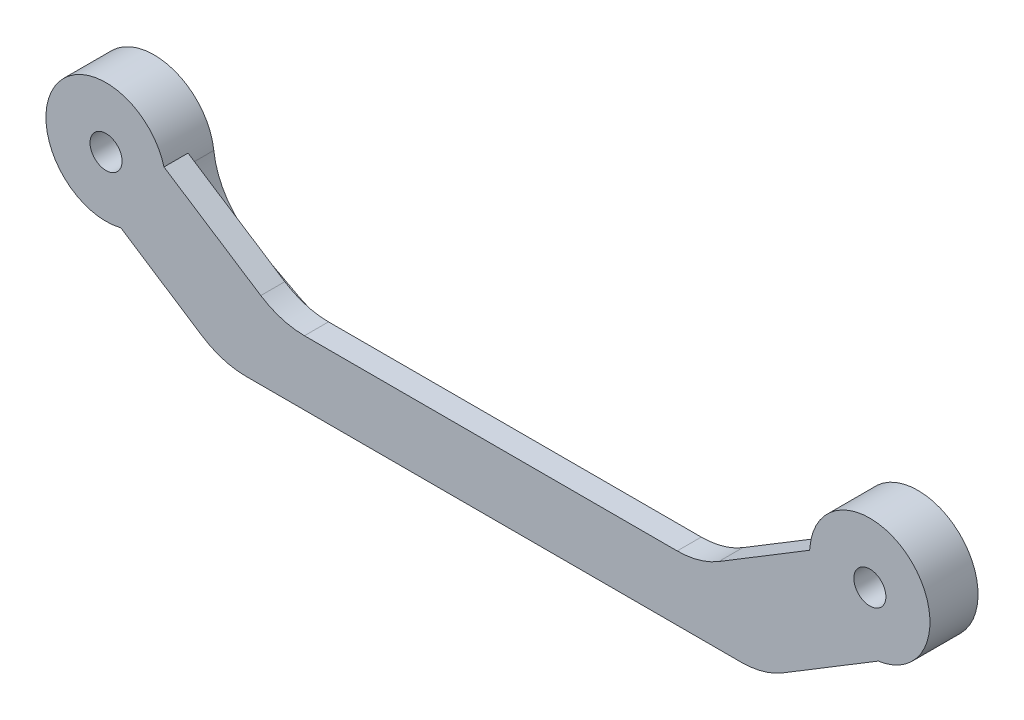
from build123d import *
from build123d.topology import SkipClean

# Parameters (mm, degrees)
EXTRUDE_1_DEPTH     = 3
SKETCH_2_R          = 2
SKETCH_2_R_2        = 1.9999999999999967
CUT_EXTRUDE_1_DEPTH = 105.01455903133225
EXTRUDE_START       = 3
SKETCH_3_R          = 1.9999999999999962
SKETCH_3_R_2        = 2
EXTRUDE_9_DEPTH     = 3
FILLET_1_R          = 10
FILLET_2_R          = 10


with BuildPart() as part:
    # 草图1 → 凸台-拉伸1 (new body)
    with BuildSketch(Plane.XY):
        with BuildLine():
            Line((21.79390335077292, -7.475214596472519), (7.229933319640558, 1.9945085092702048))
            ThreePointArc((7.229933319640558, 1.9945085092702048), (-6.483154274799016, 3.7707705643747733), (1.8411668544431816, -7.270495486148093))
            Line((1.8411668544431845, -7.270495486148092), (14.486878939127898, -15.510906506800303))
            Line((14.486878939127898, -15.510906506800302), (82.06831155956868, -15.510906506800302))
            Line((82.06831155956867, -15.510906506800302), (96.3582789784704, -6.83317051644414))
            ThreePointArc((96.35827897847041, -6.833170516444138), (100.33032000817497, 6.162825901013469), (87.812990018917, 0.8723171575890092))
            Line((87.81299001891699, 0.8723171575890003), (74.06678283695699, -7.475214596472519))
            Line((74.06678283695699, -7.475214596472519), (21.79390335077292, -7.475214596472519))
        make_face()
    extrude(amount=EXTRUDE_1_DEPTH)

    # 草图2 → 切除-拉伸1 (cut, through all)
    with BuildSketch(Plane.XY.offset(3)):
        Circle(SKETCH_2_R)
        with Locations((95.30778311888552, 0.5928956325337316)):
            Circle(SKETCH_2_R_2)
    extrude(amount=-CUT_EXTRUDE_1_DEPTH, mode=Mode.SUBTRACT)

    # 草图3 → 凸台-拉伸9 (add)
    # profile 1 of 3: a face of its own
    with SkipClean():  # the faces are left unmerged after this step: merging them gives an invalid solid
        with BuildSketch(Plane(origin=(0, 0, 0), x_dir=(-1, 0, 0), z_dir=(0, 0, -1)).offset(EXTRUDE_START)):
            with BuildLine():
                ThreePointArc((-91.01590945402396, -5.557699496790565), (-89.75367146553334, -4.447128548171897), (-88.77053253167215, -3.0832918980444344))
                ThreePointArc((-88.77053253167215, -3.0832918980444344), (-88.05246164412989, -1.3071860230668506), (-87.80778311888552, 0.5928956325337297))
                ThreePointArc((-87.80778311888552, 0.5928956325337316), (-87.80908495687888, 0.7326306500420054), (-87.812990018917, 0.8723171575890011))
                ThreePointArc((-87.81299001891699, 0.8723171575890014), (-100.33032000817497, 6.162825901013491), (-96.35827897847041, -6.833170516444131))
                ThreePointArc((-96.35827897847042, -6.833170516444138), (-93.56613473312304, -6.702079412000068), (-91.01590945402396, -5.557699496790565))
            make_face()
            with Locations(Location((-95.30778311888552, 0.5928956325337316, 0), (0, 0, 180))):
                Circle(SKETCH_3_R, mode=Mode.SUBTRACT)
        # profile 2 of 3: a face of its own
        with BuildSketch(Plane(origin=(0, 0, 0), x_dir=(-1, 0, 0), z_dir=(0, 0, -1)).offset(EXTRUDE_START)):
            with BuildLine():
                Line((-75.05143042110615, -10.798154811245045), (-88.77053253167215, -3.0832918980444335))
                ThreePointArc((-88.77053253167215, -3.0832918980444344), (-89.75367146553334, -4.447128548171897), (-91.01590945402396, -5.557699496790565))
                Line((-91.01590945402396, -5.557699496790569), (-76.64805579661679, -13.637384335527532))
                Line((-76.64805579661679, -13.637384335527532), (-18.81509472588799, -13.637384335527532))
                Line((-18.81509472588799, -13.637384335527532), (-4.475261433860523, -6.018474482674216))
                ThreePointArc((-4.475261433860524, -6.018474482674214), (-5.688218997555007, -4.8881657741789315), (-6.623200748856248, -3.5189788064650287))
                Line((-6.623200748856245, -3.5189788064650287), (-20.323608343622624, -10.798154811245045))
                Line((-20.323608343622624, -10.798154811245045), (-75.05143042110615, -10.798154811245045))
            make_face()
        # profile 3 of 3: a face of its own
        with BuildSketch(Plane(origin=(0, 0, 0), x_dir=(-1, 0, 0), z_dir=(0, 0, -1)).offset(EXTRUDE_START)):
            with BuildLine():
                ThreePointArc((-7.229933319640558, 1.9945085092702044), (-7.454996074789714, -0.8203862047048063), (-6.623200748856248, -3.5189788064650287))
                ThreePointArc((-6.623200748856248, -3.5189788064650287), (-5.688218997555007, -4.8881657741789315), (-4.475261433860524, -6.018474482674214))
                ThreePointArc((-4.475261433860524, -6.018474482674214), (-3.2196592565993294, -6.773757765922417), (-1.8411668544431843, -7.270495486148093))
                ThreePointArc((-1.8411668544431843, -7.270495486148093), (4.606584884254069, -5.918561962517747), (7.5, -1.84e-15))
                ThreePointArc((7.5, 0), (1.00635483371816, 7.432176662906506), (-7.229933319640558, 1.9945085092702044))
            make_face()
            with Locations(Location((0, 0, 0), (0, 0, 180))):
                Circle(SKETCH_3_R_2, mode=Mode.SUBTRACT)
        extrude(amount=-EXTRUDE_9_DEPTH)

    # 圆角1
    # the kernel refuses this fillet: 10 mm, written as the material it adds along each edge
    with BuildSketch(Plane(origin=(88.77053253167215, -3.083291898044434, -3), x_dir=(-0.20664882712832097, 0.9784151788716738, 0), z_dir=(0, 0, 1))) as fillet_1_piece_1_section:
        with BuildLine():
            CenterArc((7.4864083793494025, 9.541100058820126), FILLET_1_R, 197.4249522895106, 55.15009542096897)
            Line((-2.0546916794712278, 6.546536707082027), (0, 0))
            ThreePointArc((0, 0), (2.245922513804829, 0.34417495588492364), (4.491845027609668, -5e-17))
        make_face()
    fillet_1_piece_1 = extrude(amount=20.153516540869376, mode=Mode.PRIVATE)
    fillet_1_piece_1 = split(fillet_1_piece_1, bisect_by=Plane(origin=(86.96414266235654, -3.033123271198268, 3), z_dir=(0, 0, -1)), keep=Keep.TOP, mode=Mode.PRIVATE)
    add(fillet_1_piece_1)
    with BuildSketch(Plane(origin=(91.01590945402396, -5.557699496790567, -3), x_dir=(0.9194568899378542, -0.39319082841008474, 0), z_dir=(0, 0, 1))) as fillet_1_piece_2:
        with BuildLine():
            CenterArc((5.092784059285759, -9.790309907458374), FILLET_1_R, 101.75407382431756, 40.75010367707175)
            Line((-2.8411931775201964, -3.7032740766253633), (0, 0))
            ThreePointArc((0, 0), (1.5278352177857282, -0.1572675694062238), (3.055670435571466, 9e-17))
        make_face()
    extrude(amount=3)
    with BuildSketch(Plane(origin=(4.475261433860524, -6.018474482674215, -3), x_dir=(-0.9077280584793651, -0.4195590206982592, 0), z_dir=(0, 0, 1))) as fillet_1_piece_3_section:
        with BuildLine():
            CenterArc((5.124050374991801, 9.787699282299565), FILLET_1_R, 217.21105425538934, 40.96167029208499)
            Line((-2.840082184875719, 3.740171475926284), (0, 0))
            ThreePointArc((0, 0), (1.53721511249754, 0.15922553827532712), (3.0744302249950772, 4e-17))
        make_face()
    fillet_1_piece_3 = extrude(amount=14.740674354083392, mode=Mode.PRIVATE)
    fillet_1_piece_3 = split(fillet_1_piece_3, bisect_by=Plane(origin=(4.991537565692553, -6.857429506035165, 3), z_dir=(0, 0, -1)), keep=Keep.TOP, mode=Mode.PRIVATE)
    add(fillet_1_piece_3)
    with BuildSketch(Plane(origin=(6.623200748856247, -3.5189788064650287, -3), x_dir=(0.883093433180833, -0.46919717419533746, 0), z_dir=(0, 0, 1))) as fillet_1_piece_4:
        with BuildLine():
            CenterArc((6.861406616347785, 10.000000000000002), FILLET_1_R, 214.84990457904146, 55.15009542095851)
            ThreePointArc((-1.3451114501356154, 4.285714285715009), (-0.3441749558850217, 2.245922513805171), (0, 0))
            Line((0, 0), (6.861406616347784, -2e-17))
        make_face()
    extrude(amount=3)

    # 圆角2
    fillet_2_edges = [part.edges().sort_by_distance(p)[0] for p in [
        (21.79390335077292, -7.475214596472519, 1.5),
        (74.06678283695699, -7.475214596472519, 1.5),
        (82.06831155956868, -15.510906506800302, 1.5),
        (14.486878939127898, -15.510906506800303, 1.5),
        (76.64805579661679, -13.637384335527532, -1.5),
        (18.81509472588799, -13.637384335527532, -1.5),
        (20.323608343622624, -10.798154811245045, -1.5),
        (75.05143042110615, -10.798154811245045, -1.5),
    ]]
    fillet(fillet_2_edges, radius=FILLET_2_R)


solid = part.part
